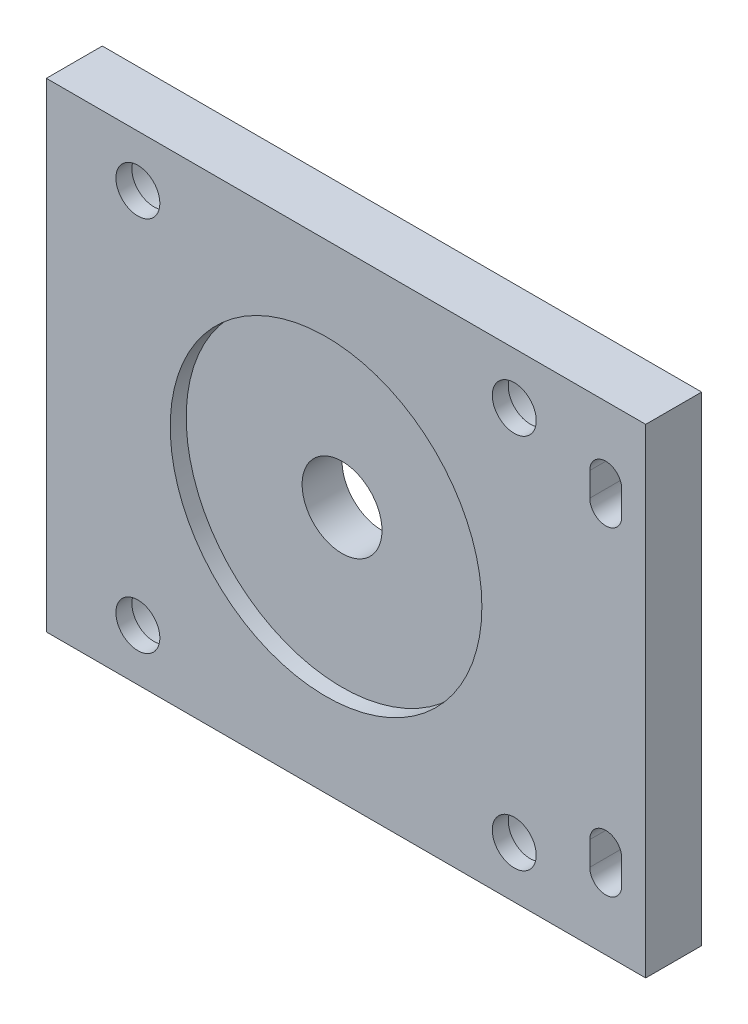
from build123d import *

# Parameters (mm, degrees)
SKETCH1_W                      = 75
SKETCH1_H                      = 60
BOSS_EXTRUDE1_DEPTH            = 7
CBORE_FOR_M5_SHCS1_D           = 5.5
CBORE_FOR_M5_SHCS1_CBORE_D     = 10
CBORE_FOR_M5_SHCS1_CBORE_DEPTH = 5
F_10_0_10_DIAMETER_HOLE1_D     = 10
SKETCH5_R                      = 19.5
CUT_EXTRUDE1_DEPTH             = 2
CUT_EXTRUDE2_DEPTH             = 49.53091798


with BuildPart() as part:
    # Sketch1 → Boss-Extrude1 (new body)
    with BuildSketch(Plane.XY):
        Rectangle(SKETCH1_W, SKETCH1_H)
    extrude(amount=BOSS_EXTRUDE1_DEPTH)

    # CBORE for M5 SHCS1 (through all)
    with Locations(Plane(origin=(21.05, 23.55, 0), x_dir=(-1, 0, 0), z_dir=(0, 0, -1))):
        with Locations((0, 0), (47.1, 0), (47.1, -47.1), (0, -47.1)):
            CounterBoreHole(CBORE_FOR_M5_SHCS1_D / 2, CBORE_FOR_M5_SHCS1_CBORE_D / 2, CBORE_FOR_M5_SHCS1_CBORE_DEPTH)

    # Ø10.0 (10) Diameter Hole1 (through all)
    with Locations(Plane(origin=(-2.5, 0, 0), x_dir=(-1, 0, 0), z_dir=(0, 0, -1))):
        with Locations((0, 0)):
            Hole(F_10_0_10_DIAMETER_HOLE1_D / 2)

    # Sketch5 → Cut-Extrude1 (cut)
    with BuildSketch(Plane.XY.offset(7)):
        with Locations((-2.5, 0)):
            Circle(SKETCH5_R)
    extrude(amount=-CUT_EXTRUDE1_DEPTH, mode=Mode.SUBTRACT)

    # Sketch6 → Cut-Extrude2 (cut, through all)
    with BuildSketch(Plane(origin=(0, 0, 0), x_dir=(-1, 0, 0), z_dir=(0, 0, -1))):
        with BuildLine():
            Line((-34.5, 18.5), (-34.5, 21.5))
            ThreePointArc((-34.5, 21.5), (-32.5, 23.5), (-30.5, 21.5))
            Line((-30.5, 21.5), (-30.5, 18.5))
            ThreePointArc((-30.5, 18.5), (-32.5, 16.5), (-34.5, 18.5))
        make_face()
        with BuildLine():
            Line((-34.5, -18.5), (-34.5, -21.5))
            ThreePointArc((-34.5, -21.5), (-32.5, -23.5), (-30.5, -21.5))
            Line((-30.5, -21.5), (-30.5, -18.5))
            ThreePointArc((-30.5, -18.5), (-32.5, -16.5), (-34.5, -18.5))
        make_face()
    extrude(amount=-CUT_EXTRUDE2_DEPTH, mode=Mode.SUBTRACT)


solid = part.part
